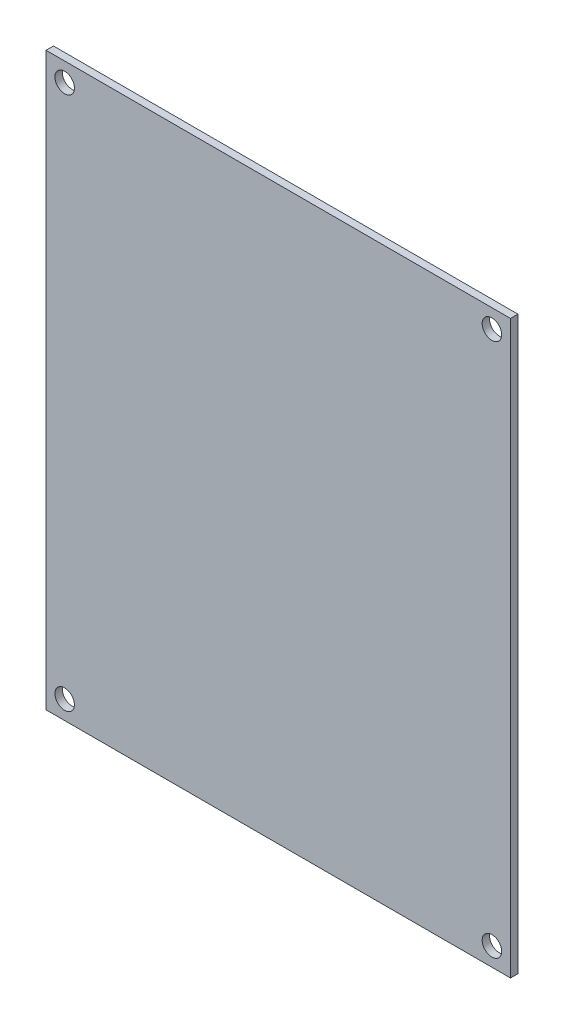
from build123d import *

# Parameters (mm, degrees)
SKETCH2_W           = 100.00010125
SKETCH2_H           = 122.9995575
SKETCH2_R           = 2.1
BOSS_EXTRUDE1_DEPTH = 1.6


with BuildPart() as part:
    # Sketch2 → Boss-Extrude1 (new body)
    with BuildSketch(Plane.XY):
        with Locations((54.167238625, 93.68082875)):
            Rectangle(SKETCH2_W, SKETCH2_H)
        with Locations((8.16763175, 151.18016)):
            Circle(SKETCH2_R, mode=Mode.SUBTRACT)
        with Locations((100.1668405, 151.18016)):
            Circle(SKETCH2_R, mode=Mode.SUBTRACT)
        with Locations((100.1668405, 36.181495)):
            Circle(SKETCH2_R, mode=Mode.SUBTRACT)
        with Locations((8.16763175, 36.181495625)):
            Circle(SKETCH2_R, mode=Mode.SUBTRACT)
    extrude(amount=BOSS_EXTRUDE1_DEPTH)


solid = part.part
